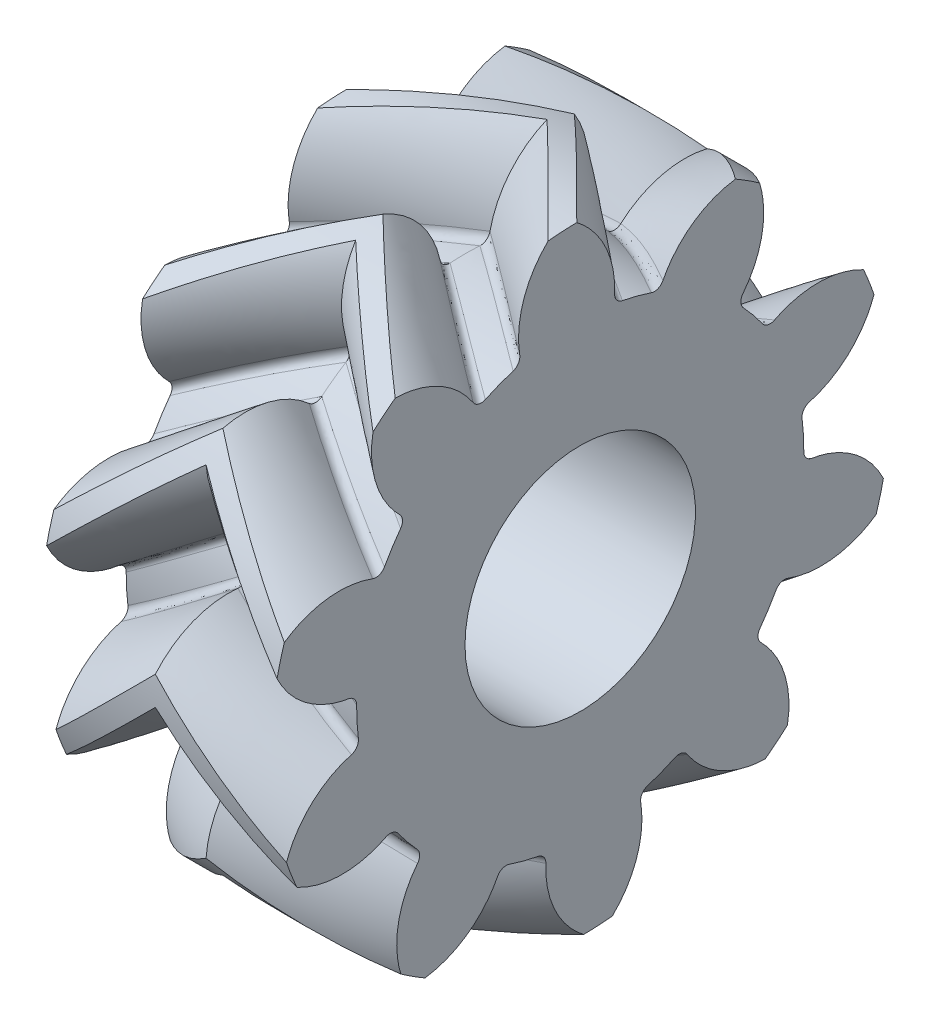
from build123d import *

# Parameters (mm, degrees)
BASPROSKE_W       = 3
BASPROSKE_H       = 8.071067812
TOOTHCUTRH_PITCH  = 50.712014689
TEETHCUTSRH_COUNT = 10
TEETHCUTSRH_ANGLE = 324
BORSKE_R          = 3
BORE_DEPTH        = 62.5000025


with BuildPart() as part:
    # BasProSke → Base-Revolve (revolve)
    with BuildSketch(Plane(origin=(0, 0, 0), x_dir=(1, 0, 0), z_dir=(0, 1, 0)), mode=Mode.PRIVATE) as base_revolve_sk:
        with Locations((1.5, 4.035533906)):
            Rectangle(BASPROSKE_W, BASPROSKE_H)
    revolve(base_revolve_sk.sketch.rotate(Axis((-10, 0, 0), (1, 0, 0)), 180), axis=Axis((-10, 0, 0), (1, 0, 0)))

    # ToothCutRH: the profile of TooCutSkeRH screwed along a right-hand helix of 0.059158 turns, 28 arcs to a turn; built about Z, then put on its axis
    toothcutrh_z = Axis((0, 0, 0), (0, 0, 1))
    toothcutrh_corners = [(5.808100379, -0.388330349, 0), (5.808100379, 0.388330349, 0), (6.005166342, 0.650334151, 0), (7.913261622, 2.547465837, 0), (7.913261622, -2.547465837, 0), (6.005166342, -0.650334151, 0)]
    with BuildLine(mode=Mode.PRIVATE) as toothcutrh_profile:
        ThreePointArc((5.808100379, -0.388330349, 0), (5.821067812, 0, 0), (5.808100379, 0.388330349, 0))
        ThreePointArc((5.808100379, 0.388330349, 0), (5.857948362, 0.555950635, 0), (6.005166342, 0.650334151, 0))
        ThreePointArc((6.005166342, 0.650334151, 0), (7.236210278, 1.320302926, 0), (7.913261622, 2.547465837, 0))
        ThreePointArc((7.913261622, 2.547465837, 0), (8.313199846, 0, 0), (7.913261622, -2.547465837, 0))
        ThreePointArc((7.913261622, -2.547465837, 0), (7.236210278, -1.320302926, 0), (6.005166342, -0.650334151, 0))
        ThreePointArc((6.005166342, -0.650334151, 0), (5.857948362, -0.555950635, 0), (5.808100379, -0.388330349, 0))
    toothcutrh_cap = Face(toothcutrh_profile.wire())
    toothcutrh_arcs = [((5.808100379, -0.388330349, 0), (5.834064197, 0, 0), (5.808100379, 0.388330349, 0), (1, 0.9977723274373045, 1)), ((5.808100379, 0.388330349, 0), (5.793660295, 0.604304856, 0), (6.005166342, 0.650334151, 0), (1, 0.7572944747954665, 1)), ((6.005166342, 0.650334151, 0), (7.564851251, 0.989762725, 0), (7.913261622, 2.547465837, 0), (1, 0.8428538133406206, 1)), ((7.913261622, 2.547465837, 0), (8.733351049, 0, 0), (7.913261622, -2.547465837, 0), (1, 0.9518911812471264, 1)), ((7.913261622, -2.547465837, 0), (7.564851251, -0.989762725, 0), (6.005166342, -0.650334151, 0), (1, 0.84285381334062, 1)), ((6.005166342, -0.650334151, 0), (5.793660295, -0.604304856, 0), (5.808100379, -0.388330349, 0), (1, 0.757294474795466, 1))]  # start, shoulder, end, weights
    toothcutrh_turn_angles = [0, 6.428571429, 12.857142857, 17.076935595, 21.296728332]
    toothcutrh_turn_weights = [1, 0.9937122098932426, 1, 0.9972891176971639, 1]
    toothcutrh_turn_sides = [Face.make_bezier_surface([[Vector(p[j][0], p[j][1], 0).rotate(toothcutrh_z, toothcutrh_turn_angles[2 * i + k]) / toothcutrh_turn_weights[2 * i + k] + Vector(0, 0, p[j][2] + TOOTHCUTRH_PITCH * toothcutrh_turn_angles[2 * i + k] / 360) for k in range(3)] for j in range(3)], [[p[3][j] * toothcutrh_turn_weights[2 * i + k] for k in range(3)] for j in range(3)]) for p in toothcutrh_arcs for i in range(2)]
    toothcutrh = Plane(origin=(0, 0, 0), x_dir=(0, 1, 0), z_dir=(1, 0, 0)) * Solid(Shell([*toothcutrh_turn_sides, toothcutrh_cap, toothcutrh_cap.rotate(toothcutrh_z, 21.296728332).moved(Location((0, 0, TOOTHCUTRH_PITCH * 21.296728332 / 360)))]))
    add(toothcutrh, mode=Mode.SUBTRACT)

    # TeethCutsRH: ToothCutRH ×10 about axis
    teethcutsrh_axis = Axis((-10, 0, 0), (1, 0, 0))
    for i in range(1, TEETHCUTSRH_COUNT):
        add(toothcutrh.rotate(teethcutsrh_axis, i * TEETHCUTSRH_ANGLE / (TEETHCUTSRH_COUNT - 1)), mode=Mode.SUBTRACT)

    # BorSke → Bore (cut, symmetric)
    with BuildSketch(Plane(origin=(0, 0, 0), x_dir=(0, 0, -1), z_dir=(1, 0, 0))):
        with Locations(Location((0, 0, 0), (0, 0, 180))):
            Circle(BORSKE_R)
    extrude(amount=BORE_DEPTH, both=True, mode=Mode.SUBTRACT)

    # Mirror1: part across plane


with BuildPart() as part_1:
    add(part.part)
    add(part.part.mirror(Plane(origin=(0, 0, 0), x_dir=(0, 0, 1), z_dir=(1, 0, 0))))


solid = part_1.part
